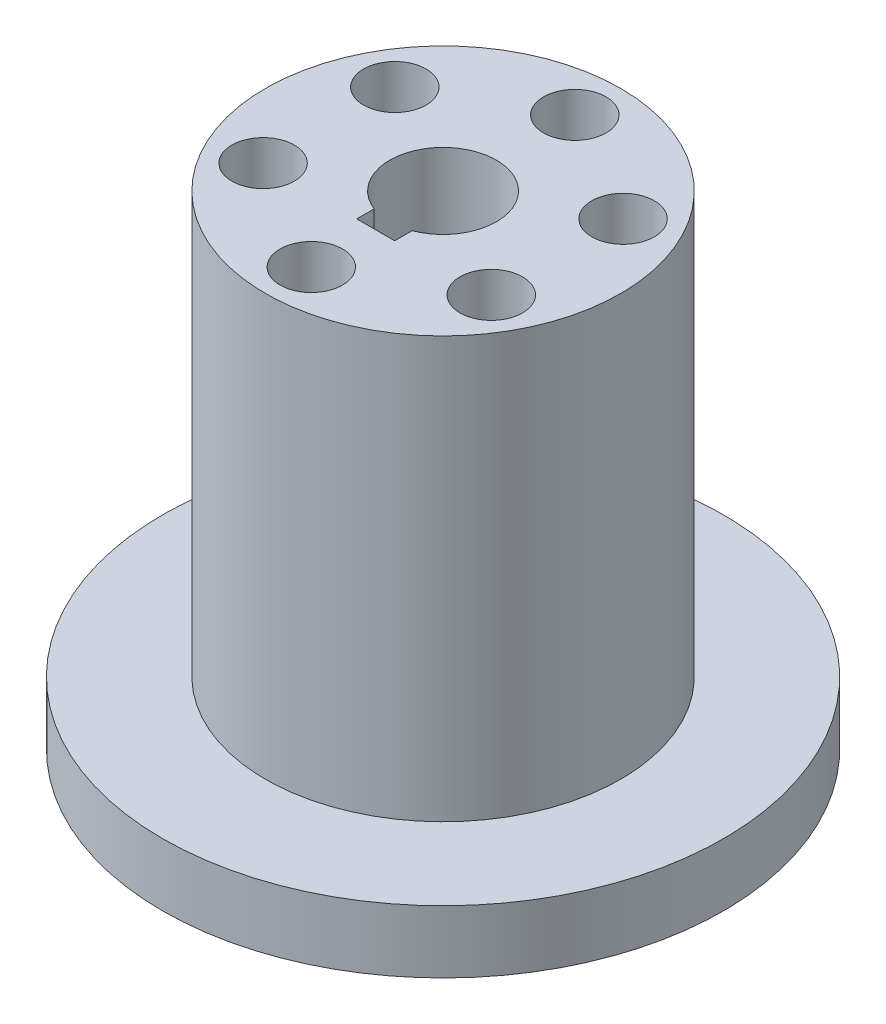
from build123d import *

# Parameters (mm, degrees)
SKETCH1_R           = 38.1
BOSS_EXTRUDE1_DEPTH = 8.5
SKETCH2_R           = 24.13
BOSS_EXTRUDE2_DEPTH = 57.15
SKETCH3_R           = 4.25
CUT_EXTRUDE1_DEPTH  = 78.54
SKETCH4_R           = 6.75
CUT_EXTRUDE2_DEPTH  = 8
CUT_EXTRUDE3_DEPTH  = 91


with BuildPart() as part:
    # Sketch1 → Boss-Extrude1 (new body)
    with BuildSketch(Plane(origin=(0, 0, 0), x_dir=(1, 0, 0), z_dir=(0, 1, 0))):
        Circle(SKETCH1_R)
    extrude(amount=BOSS_EXTRUDE1_DEPTH)

    # Sketch2 → Boss-Extrude2 (add)
    with BuildSketch(Plane(origin=(0, 8.5, 0), x_dir=(1, 0, 0), z_dir=(0, 1, 0))):
        Circle(SKETCH2_R)
    extrude(amount=BOSS_EXTRUDE2_DEPTH)

    # Sketch3 → Cut-Extrude1 (cut)
    with BuildSketch(Plane(origin=(0, 65.65, 0), x_dir=(1, 0, 0), z_dir=(0, 1, 0))):
        with Locations((0, 17.897858345)):
            Circle(SKETCH3_R)
        with Locations((-15.5, 8.948929172)):
            Circle(SKETCH3_R)
        with Locations((15.5, 8.948929172)):
            Circle(SKETCH3_R)
        with Locations((-15.5, -8.948929172)):
            Circle(SKETCH3_R)
        with Locations((15.5, -8.948929172)):
            Circle(SKETCH3_R)
        with Locations((0, -17.897858345)):
            Circle(SKETCH3_R)
    extrude(amount=-CUT_EXTRUDE1_DEPTH, mode=Mode.SUBTRACT)

    # Sketch4 → Cut-Extrude2 (cut)
    with BuildSketch(Plane.XZ):
        with Locations((-15.5, 8.948929172)):
            Circle(SKETCH4_R)
        with Locations((0, 17.897858345)):
            Circle(SKETCH4_R)
        with Locations((15.5, 8.948929172)):
            Circle(SKETCH4_R)
        with Locations((15.5, -8.948929172)):
            Circle(SKETCH4_R)
        with Locations((0, -17.897858345)):
            Circle(SKETCH4_R)
        with Locations((-15.5, -8.948929172)):
            Circle(SKETCH4_R)
    extrude(amount=-CUT_EXTRUDE2_DEPTH, mode=Mode.SUBTRACT)

    # Sketch5 → Cut-Extrude3 (cut)
    with BuildSketch(Plane.XZ):
        with BuildLine():
            Line((2.575, 9.15), (-2.575, 9.15))
            Line((-2.575, 9.15), (-2.575, 6.777305881))
            ThreePointArc((-2.575, 6.777305881), (0, -7.25), (2.575, 6.777305881))
            Line((2.575, 6.777305881), (2.575, 9.15))
        make_face()
    extrude(amount=-CUT_EXTRUDE3_DEPTH, mode=Mode.SUBTRACT)


solid = part.part
